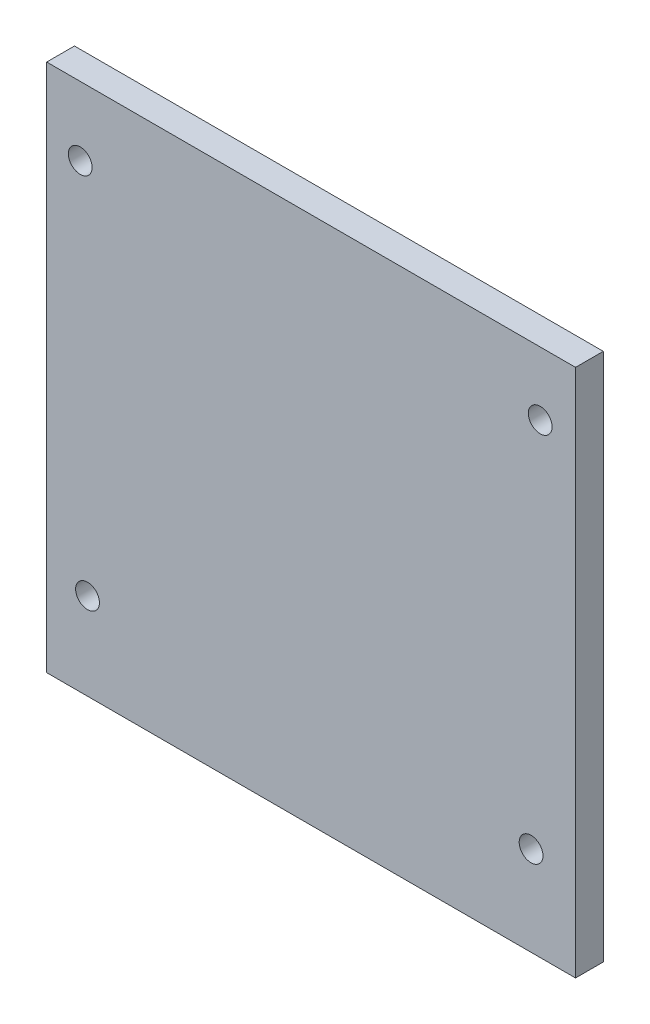
from build123d import *

# Parameters (mm, degrees)
SKETCH1_W           = 101.6
SKETCH1_H           = 101.6
BOSS_EXTRUDE1_DEPTH = 5.334
SKETCH2_R           = 2.286
CUT_EXTRUDE1_DEPTH  = 73.039791477


with BuildPart() as part:
    # Sketch1 → Boss-Extrude1 (new body)
    with BuildSketch(Plane.XY):
        Rectangle(SKETCH1_W, SKETCH1_H)
    extrude(amount=BOSS_EXTRUDE1_DEPTH)

    # Sketch2 → Cut-Extrude1 (cut, through all)
    with BuildSketch(Plane(origin=(0, 0, 0), x_dir=(-1, 0, 0), z_dir=(0, 0, -1))):
        with Locations((-42.259312367, -33.61511472)):
            Circle(SKETCH2_R)
        with Locations((42.95939041, -34.102988475)):
            Circle(SKETCH2_R)
        with Locations((44.353227794, 37.613683547)):
            Circle(SKETCH2_R)
        with Locations((-44.009030347, 38.636511897)):
            Circle(SKETCH2_R)
    extrude(amount=-CUT_EXTRUDE1_DEPTH, mode=Mode.SUBTRACT)


solid = part.part
